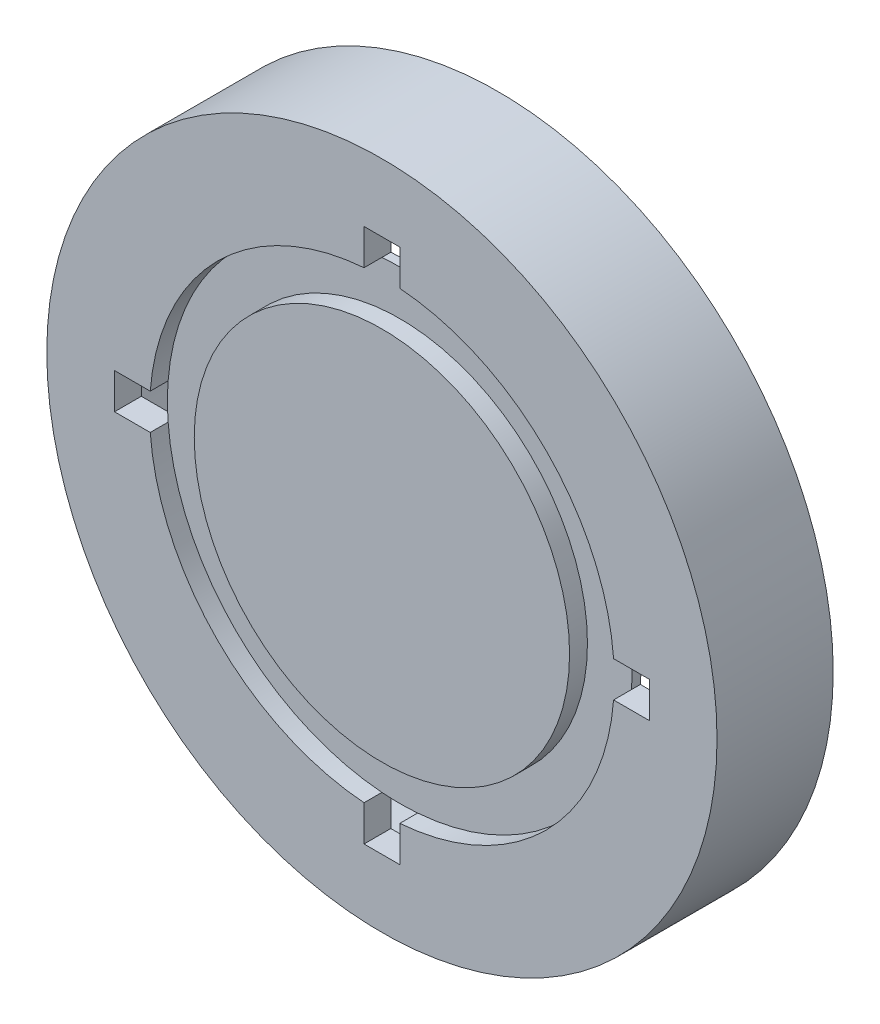
from build123d import *

# Parameters (mm, degrees)
SKETCH1_R           = 47.625
BOSS_EXTRUDE1_DEPTH = 3.81
SKETCH2_R           = 33.02
SKETCH2_R_2         = 26.67
CUT_EXTRUDE1_DEPTH  = 2.54
CUT_EXTRUDE2_DEPTH  = 68.459597909
BOSS_EXTRUDE2_START = 12.7
SKETCH4_R           = 47.625
SKETCH4_R_2         = 44.45
BOSS_EXTRUDE2_DEPTH = 12.7


with BuildPart() as part:
    # Sketch1 → Boss-Extrude1 (new body)
    with BuildSketch(Plane.XY):
        Circle(SKETCH1_R)
    extrude(amount=BOSS_EXTRUDE1_DEPTH)

    # Sketch2 → Cut-Extrude1 (cut)
    with BuildSketch(Plane.XY.offset(3.81)):
        Circle(SKETCH2_R)
        Circle(SKETCH2_R_2, mode=Mode.SUBTRACT)
    extrude(amount=-CUT_EXTRUDE1_DEPTH, mode=Mode.SUBTRACT)

    # Sketch3 → Cut-Extrude2 (cut, through all)
    with BuildSketch(Plane.XY.offset(3.81)):
        with BuildLine():
            ThreePointArc((32.922162748, 2.54), (33.02, 0), (32.922162748, -2.54))
            Line((32.922162748, -2.54), (38.002162748, -2.54))
            Line((38.002162748, -2.54), (38.002162748, 2.54))
            Line((38.002162748, 2.54), (32.922162748, 2.54))
        make_face()
        with BuildLine():
            Line((2.54, -38.002162748), (2.54, -32.922162748))
            ThreePointArc((2.54, -32.922162748), (0, -33.02), (-2.54, -32.922162748))
            Line((-2.54, -32.922162748), (-2.54, -38.002162748))
            Line((-2.54, -38.002162748), (2.54, -38.002162748))
        make_face()
        with BuildLine():
            Line((2.54, 32.922162748), (2.54, 38.002162748))
            Line((2.54, 38.002162748), (-2.54, 38.002162748))
            Line((-2.54, 38.002162748), (-2.54, 32.922162748))
            ThreePointArc((-2.54, 32.922162748), (0, 33.02), (2.54, 32.922162748))
        make_face()
        with BuildLine():
            Line((-38.002162748, -2.54), (-32.922162748, -2.54))
            ThreePointArc((-32.922162748, -2.54), (-33.02, 0), (-32.922162748, 2.54))
            Line((-32.922162748, 2.54), (-38.002162748, 2.54))
            Line((-38.002162748, 2.54), (-38.002162748, -2.54))
        make_face()
    extrude(amount=-CUT_EXTRUDE2_DEPTH, mode=Mode.SUBTRACT)

    # Sketch4 → Boss-Extrude2 (add)
    with BuildSketch(Plane(origin=(0, 0, 0), x_dir=(-1, 0, 0), z_dir=(0, 0, -1)).offset(BOSS_EXTRUDE2_START)):
        Circle(SKETCH4_R)
        Circle(SKETCH4_R_2, mode=Mode.SUBTRACT)
    extrude(amount=-BOSS_EXTRUDE2_DEPTH)


solid = part.part
